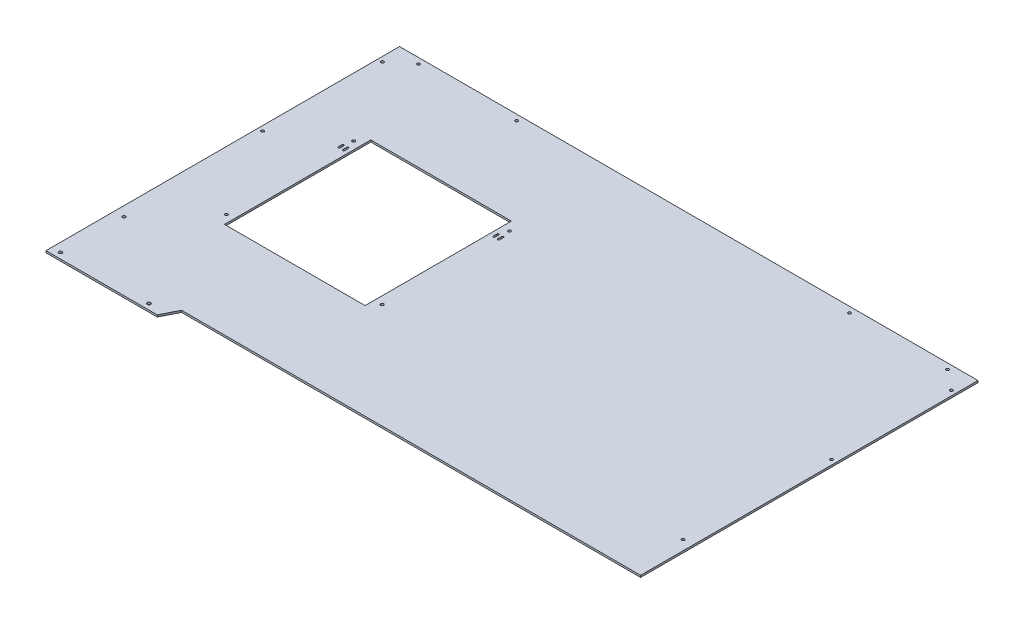
from build123d import *

# Parameters (mm, degrees)
EXTRUDE_1_DEPTH     = 2
SKETCH_2_R          = 1.525
SKETCH_2_R_2        = 1.75
CUT_EXTRUDE_1_DEPTH = 2
SKETCH_3_W          = 2
SKETCH_3_H          = 6
CUT_EXTRUDE_2_DEPTH = 10
FILLET_2_R          = 1


with BuildPart() as part:
    # 草图1 → 凸台-拉伸1 (new body)
    with BuildSketch(Plane(origin=(0, 0, 0), x_dir=(1, 0, 0), z_dir=(0, 1, 0))):
        Polygon((0, 0), (0, 372.1), (608.8, 372.1), (608.8, 17), (125.65, 17), (117.15, 0), align=None)
    extrude(amount=EXTRUDE_1_DEPTH)

    # 草图2 → 切除-拉伸1 (cut)
    with BuildSketch(Plane(origin=(0, 2, 0), x_dir=(1, 0, 0), z_dir=(0, 1, 0))):
        with Locations(Location((5, 349.1, 0), (0, 0, 270))):
            Circle(SKETCH_2_R)
        with Locations(Location((26, 366.1, 0), (0, 0, 270))):
            Circle(SKETCH_2_R)
        with Locations(Location((129.25, 366.1, 0), (0, 0, 270))):
            Circle(SKETCH_2_R)
        with Locations(Location((5, 223.05, 0), (0, 0, 270))):
            Circle(SKETCH_2_R)
        with Locations(Location((603.8, 223.05, 0), (0, 0, 90))):
            Circle(SKETCH_2_R)
        with Locations(Location((479.55, 366.1, 0), (0, 0, 90))):
            Circle(SKETCH_2_R)
        with Locations(Location((582.8, 366.1, 0), (0, 0, 90))):
            Circle(SKETCH_2_R)
        with Locations(Location((603.8, 349.1, 0), (0, 0, 90))):
            Circle(SKETCH_2_R)
        with Locations(Location((10.2, 71.95, 0), (0, 0, 270))):
            Circle(SKETCH_2_R)
        with Locations(Location((598.6, 71.95, 0), (0, 0, 90))):
            Circle(SKETCH_2_R)
        with Locations(Location((9.2, 6, 0), (0, 0, 270))):
            Circle(SKETCH_2_R_2)
        with Locations(Location((102.4, 6, 0), (0, 0, 270))):
            Circle(SKETCH_2_R_2)
        with Locations(Location((62, 261.85, 0), (0, 0, 270))):
            Circle(SKETCH_2_R)
        with Locations(Location((62, 127.85, 0), (0, 0, 270))):
            Circle(SKETCH_2_R)
        with Locations(Location((226, 261.85, 0), (0, 0, 270))):
            Circle(SKETCH_2_R)
        with Locations(Location((226, 127.85, 0), (0, 0, 270))):
            Circle(SKETCH_2_R)
        Polygon((70, 271.85), (75, 271.85), (94, 271.85), (155, 271.85), (184, 271.85), (218, 271.85), (218, 117.85), (70, 117.85), align=None)
    extrude(amount=-CUT_EXTRUDE_1_DEPTH, mode=Mode.SUBTRACT)

    # 草图3 → 切除-拉伸2 (cut)
    with BuildSketch(Plane(origin=(0, 2, 0), x_dir=(1, 0, 0), z_dir=(0, 1, 0))):
        with Locations((65, 250.330488495)):
            Rectangle(SKETCH_3_W, SKETCH_3_H)
        with Locations((60.132371309, 250.330488495)):
            Rectangle(SKETCH_3_W, SKETCH_3_H)
        with Locations((227.867628691, 250.647738708)):
            Rectangle(SKETCH_3_W, SKETCH_3_H)
        with Locations((223, 250.647738708)):
            Rectangle(SKETCH_3_W, SKETCH_3_H)
    extrude(amount=-CUT_EXTRUDE_2_DEPTH, mode=Mode.SUBTRACT)

    # 圆角2
    fillet_2_edges = [part.edges().sort_by_distance(p)[0] for p in [
        (61.132371309, 1, -247.330488495),
        (59.132371309, 1, -247.330488495),
        (66, 1, -247.330488495),
        (64, 1, -247.330488495),
        (59.132371309, 1, -253.330488495),
        (61.132371309, 1, -253.330488495),
        (228.867628691, 1, -247.647738708),
        (222, 1, -247.647738708),
        (228.867628691, 1, -253.647738708),
        (224, 1, -253.647738708),
        (226.867628691, 1, -253.647738708),
        (222, 1, -253.647738708),
        (64, 1, -253.330488495),
        (66, 1, -253.330488495),
        (224, 1, -247.647738708),
        (226.867628691, 1, -247.647738708),
    ]]
    fillet(fillet_2_edges, radius=FILLET_2_R - 0.0001)  # a hair under: the kernel refuses the full size


solid = part.part
